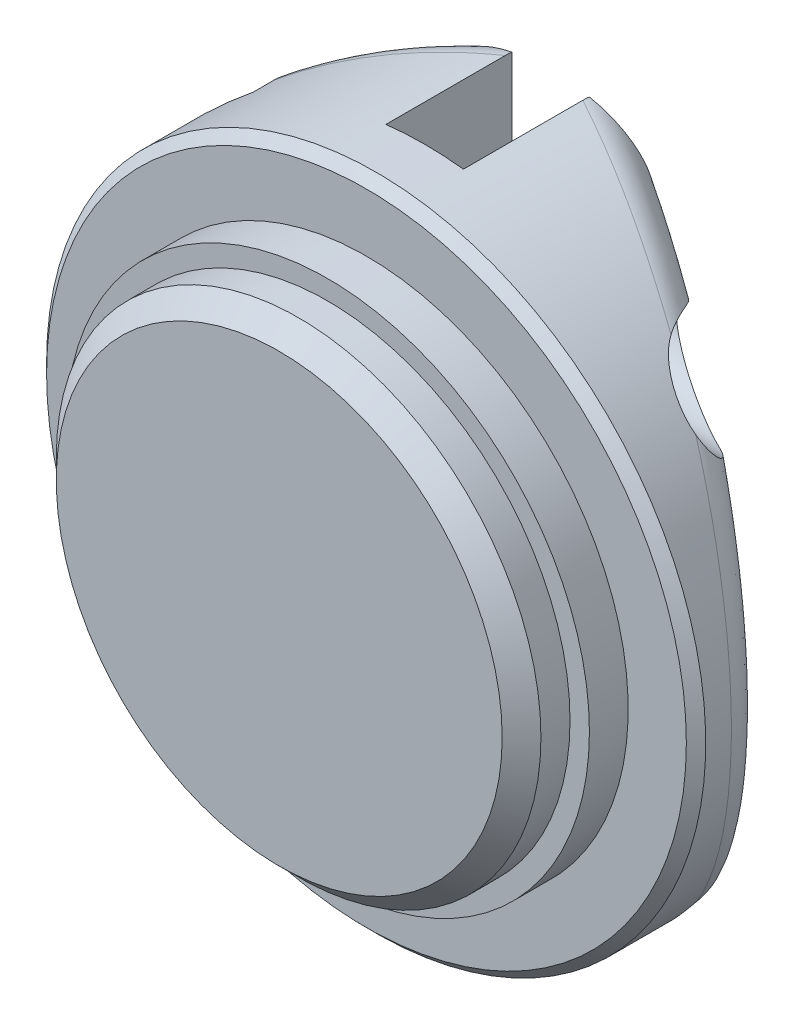
from build123d import *
from build123d.topology import SkipClean

# Parameters (mm, degrees)
SKETCH1_R               = 12.5
BOSS_EXTRUDE1_DEPTH     = 4.5
SKETCH2_R               = 17
BOSS_EXTRUDE2_DEPTH     = 3
CHAMFER1_SIZE           = 1
BOSS_EXTRUDE3_DEPTH     = 20
CUT_EXTRUDE1_DEPTH      = 28.915049704
CUT_EXTRUDE1_DEPTH_BACK = 28.915049704
SKETCH4_R               = 1.25
SKETCH5_R               = 13.5
BOSS_EXTRUDE4_DEPTH     = 2
CUT_EXTRUDE2_DEPTH      = 30.748949561
CUT_EXTRUDE2_DEPTH_BACK = 30.748949561
SKETCH6_W               = 46.724377104
SKETCH6_H               = 45.890013228
SKETCH6_R               = 17
SKETCH7_W               = 4
SKETCH7_H               = 14
CUT_EXTRUDE3_DEPTH      = 3
CUT_EXTRUDE4_START      = 6
SKETCH8_R               = 2.25
CUT_EXTRUDE4_DEPTH      = 33
CUT_EXTRUDE5_START      = -5
CUT_EXTRUDE5_DEPTH      = 33
FILLET1_R               = 2
CHAMFER2_SIZE           = 0.5


with BuildPart() as part:
    # Sketch1 → Boss-Extrude1 (new body)
    with BuildSketch(Plane.XY):
        Circle(SKETCH1_R)
    extrude(amount=BOSS_EXTRUDE1_DEPTH)

    # Sketch2 → Boss-Extrude2 (add)
    with BuildSketch(Plane(origin=(0, 0, 0), x_dir=(-1, 0, 0), z_dir=(0, 0, -1))):
        Circle(SKETCH2_R)
    extrude(amount=BOSS_EXTRUDE2_DEPTH)

    # Chamfer1
    chamfer1_edges = [part.edges().sort_by_distance(p)[0] for p in [
        (-12.5, 0, 4.5),
    ]]
    chamfer(chamfer1_edges, length=CHAMFER1_SIZE)

    # Sketch3 → Boss-Extrude3 (add, symmetric)
    with BuildSketch(Plane(origin=(0, 0, 0), x_dir=(1, 0, 0), z_dir=(0, 1, 0))):
        Polygon((-17, 3), (-5.273971877, 9.5), (-2, 9.5), (-2, 3), align=None)
        Polygon((17, 3), (2, 3), (2, 9.5), (5.273971877, 9.5), align=None)
    extrude(amount=BOSS_EXTRUDE3_DEPTH, both=True)

    # Sketch4 → Cut-Extrude1 (cut, two sides: drawn at the far end of the back side and taken through both)
    with BuildSketch(Plane(origin=(0, 0, 0), x_dir=(0, 0, -1), z_dir=(1, 0, 0)).offset(-CUT_EXTRUDE1_DEPTH_BACK)):
        with Locations((5.75, 11)):
            Circle(SKETCH4_R)
        with Locations((5.75, -11)):
            Circle(SKETCH4_R)
    extrude(amount=CUT_EXTRUDE1_DEPTH + CUT_EXTRUDE1_DEPTH_BACK, mode=Mode.SUBTRACT)

    # Sketch5 → Boss-Extrude4 (add)
    with BuildSketch(Plane.XY):
        Circle(SKETCH5_R)
    extrude(amount=BOSS_EXTRUDE4_DEPTH)

    # Sketch6 → Cut-Extrude2 (cut, two sides: drawn at the far end of the back side and taken through both)
    with SkipClean():  # the faces are left unmerged after this step: merging them gives an invalid solid
        with BuildSketch(Plane.XY.offset(4.5).offset(-CUT_EXTRUDE2_DEPTH_BACK)):
            Rectangle(SKETCH6_W, SKETCH6_H)
            Circle(SKETCH6_R, mode=Mode.SUBTRACT)
        extrude(amount=CUT_EXTRUDE2_DEPTH + CUT_EXTRUDE2_DEPTH_BACK, mode=Mode.SUBTRACT)

    # Sketch7 → Cut-Extrude3 (cut)
    with SkipClean():  # the faces are left unmerged after this step: merging them gives an invalid solid
        with BuildSketch(Plane(origin=(0, 0, -3), x_dir=(-1, 0, 0), z_dir=(0, 0, -1))):
            Rectangle(SKETCH7_W, SKETCH7_H)
        extrude(amount=-CUT_EXTRUDE3_DEPTH, mode=Mode.SUBTRACT)

    # Sketch8 → Cut-Extrude4 (cut)
    with SkipClean():  # the faces are left unmerged after this step: merging them gives an invalid solid
        with BuildSketch(Plane(origin=(0, 0, 0), x_dir=(0, 0, -1), z_dir=(1, 0, 0)).offset(CUT_EXTRUDE4_START)):
            with Locations((5.75, 11)):
                Circle(SKETCH8_R)
            with Locations((5.75, -11)):
                Circle(SKETCH8_R)
        extrude(amount=CUT_EXTRUDE4_DEPTH, mode=Mode.SUBTRACT)

    # Sketch9 → Cut-Extrude5 (cut)
    with BuildSketch(Plane(origin=(0, 0, 0), x_dir=(0, 0, -1), z_dir=(1, 0, 0)).offset(CUT_EXTRUDE5_START)):
        Polygon((7.33771324, 8.25), (8.925426481, 11), (7.33771324, 13.75), (4.16228676, 13.75), (2.574573519, 11), (4.16228676, 8.25), align=None)
        Polygon((4.16228676, -13.75), (7.33771324, -13.75), (8.925426481, -11), (7.33771324, -8.25), (4.16228676, -8.25), (2.574573519, -11), align=None)
    extrude(amount=-CUT_EXTRUDE5_DEPTH, mode=Mode.SUBTRACT)

    # Fillet1
    fillet1_edges = [part.edges().sort_by_distance(p)[0] for p in [
        (8.144091596, 14.922257607, -7.909028362),
        (16.304229234, 4.813741692, -3.385681318),
        (8.144091596, -14.922257607, -7.909028362),
        (-7.711571864, -15.150302287, -8.148783736),
        (-7.711571864, 15.150302287, -8.148783736),
        (-16.447536722, -4.298666744, -3.306242768),
    ]]
    fillet(fillet1_edges, radius=FILLET1_R)

    # Chamfer2
    chamfer2_edges = [part.edges().sort_by_distance(p)[0] for p in [
        (17, 0, 0),
    ]]
    chamfer(chamfer2_edges, length=CHAMFER2_SIZE)


solid = part.part
